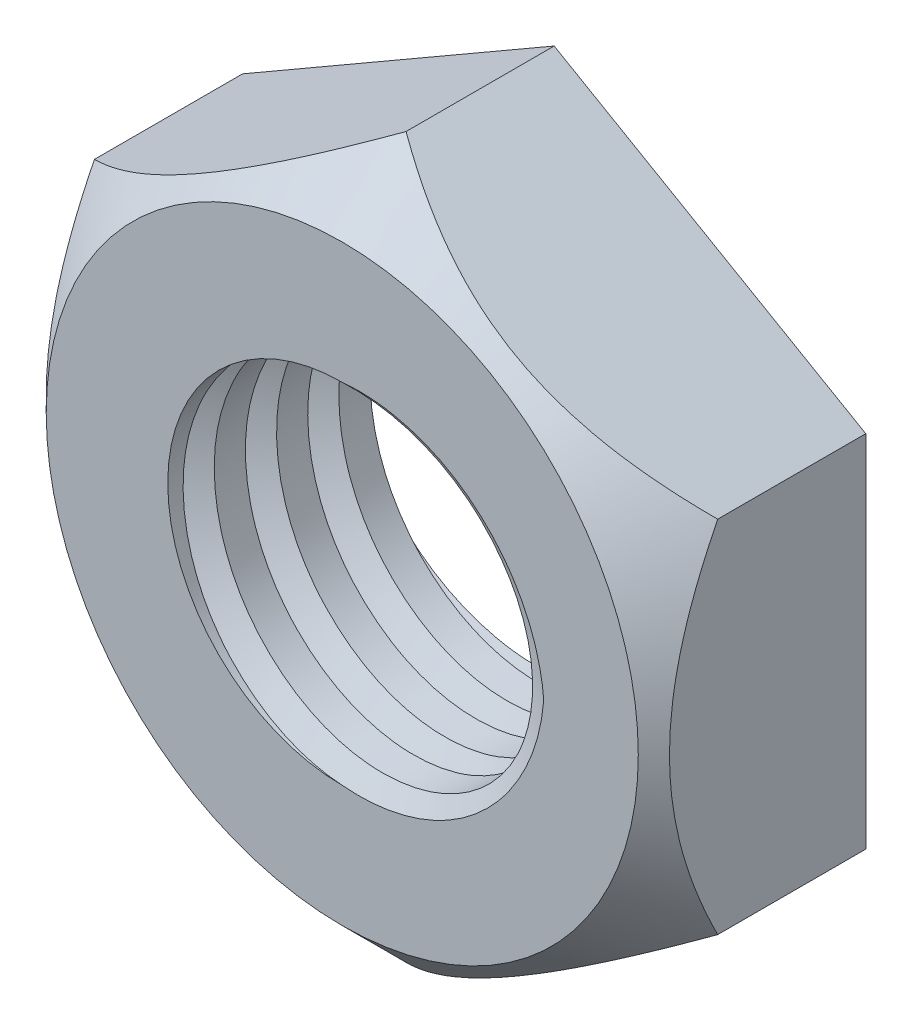
from build123d import *

# Parameters (mm, degrees)
SKETCH1_R           = 2.8
BOSS_EXTRUDE1_DEPTH = 3.4
CUT_SWEEP2_PITCH    = 1
SKETCH8_OUTSIDE_W   = 21.93
SKETCH8_OUTSIDE_H   = 23.478
SKETCH8_OUTSIDE_R   = 4.75
CUT_EXTRUDE1_DEPTH  = 3.4
CUT_EXTRUDE1_DRAFT  = -45


with BuildPart() as part:
    # Sketch1 → Boss-Extrude1 (new body)
    with BuildSketch(Plane.XY):
        Polygon((5, 2.886751346), (0, 5.773502692), (-5, 2.886751346), (-5, -2.886751346), (0, -5.773502692), (5, -2.886751346), align=None)
        Circle(SKETCH1_R, mode=Mode.SUBTRACT)
    extrude(amount=BOSS_EXTRUDE1_DEPTH)

    # Cut-Sweep2: arcs per turn and ends read off the stored shape
    # Cut-Sweep2: the profile of Sketch4 screwed along a right-hand helix through 7 turns, 8 arcs to a turn; built about Z, then put on its axis
    cut_sweep2_z = Axis((0, 0, 0), (0, 0, 1))
    cut_sweep2_corners = [(3.233012702, 0, -1), (2.583493649, 0, -0.625), (2.583493649, 0, -1.375)]
    with BuildLine(mode=Mode.PRIVATE) as cut_sweep2_profile:
        Line(cut_sweep2_corners[0], cut_sweep2_corners[1])
        Line(cut_sweep2_corners[1], cut_sweep2_corners[2])
        Line(cut_sweep2_corners[2], cut_sweep2_corners[0])
    cut_sweep2_cap = Face(cut_sweep2_profile.wire())
    cut_sweep2_turn_angles = [0, 22.5, 45, 67.5, 90, 112.5, 135, 157.5, 180, 202.5, 225, 247.5, 270, 292.5, 315, 337.5, 360]
    cut_sweep2_turn_weights = [1, 0.9238795325112867, 1, 0.9238795325112867, 1, 0.9238795325112867, 1, 0.9238795325112867, 1, 0.9238795325112867, 1, 0.9238795325112867, 1, 0.9238795325112867, 1, 0.9238795325112867, 1]
    cut_sweep2_turn_rails = [Edge.make_bspline([Vector(p[0], p[1], 0).rotate(cut_sweep2_z, cut_sweep2_turn_angles[k]) / cut_sweep2_turn_weights[k] + Vector(0, 0, p[2] + CUT_SWEEP2_PITCH * cut_sweep2_turn_angles[k] / 360) for k in range(17)], [0, 0, 0, 1, 1, 2, 2, 3, 3, 4, 4, 5, 5, 6, 6, 7, 7, 8, 8, 8], 2, cut_sweep2_turn_weights) for p in cut_sweep2_corners]
    cut_sweep2_turn_sides = [Face.make_surface_from_curves(cut_sweep2_turn_rails[p[0]], cut_sweep2_turn_rails[p[1]]) for p in [(0, 1), (1, 2), (2, 0)]]
    cut_sweep2 = Plane(origin=(0, 0, 3.4), x_dir=(1, 0, 0), z_dir=(0, 0, -1)) * Solid(Shell([*[p.moved(Location((0, 0, CUT_SWEEP2_PITCH * i))) for i in range(7) for p in cut_sweep2_turn_sides], cut_sweep2_cap, cut_sweep2_cap.rotate(cut_sweep2_z, 2520).moved(Location((0, 0, CUT_SWEEP2_PITCH * 2520 / 360)))]))
    add(cut_sweep2, mode=Mode.SUBTRACT)


with BuildPart() as cut_extrude1_tool:
    # Sketch8 outside → Cut-Extrude1 (with draft: the straight prism first)
    with BuildSketch(Plane.XY.offset(3.4)):
        Rectangle(SKETCH8_OUTSIDE_W, SKETCH8_OUTSIDE_H)
        Circle(SKETCH8_OUTSIDE_R, mode=Mode.SUBTRACT)
    extrude(amount=-CUT_EXTRUDE1_DEPTH)
    # Cut-Extrude1: the draft: its side faces are tilted about the plane it starts from
    cut_extrude1_sides = [cut_extrude1_tool.faces().sort_by_distance(p)[0] for p in [
        (0, -11.739, 1.7),
        (10.965, 0, 1.7),
        (0, 11.739, 1.7),
        (-10.965, 0, 1.7),
        (-4.75, 0, 1.7),
    ]]
    draft(cut_extrude1_sides, Plane.XY.offset(3.4), CUT_EXTRUDE1_DRAFT)


with BuildPart() as part_1:
    add(part.part)

    # Cut-Extrude1: cut by cut_extrude1_tool
    add(cut_extrude1_tool.part, mode=Mode.SUBTRACT)


solid = part_1.part
